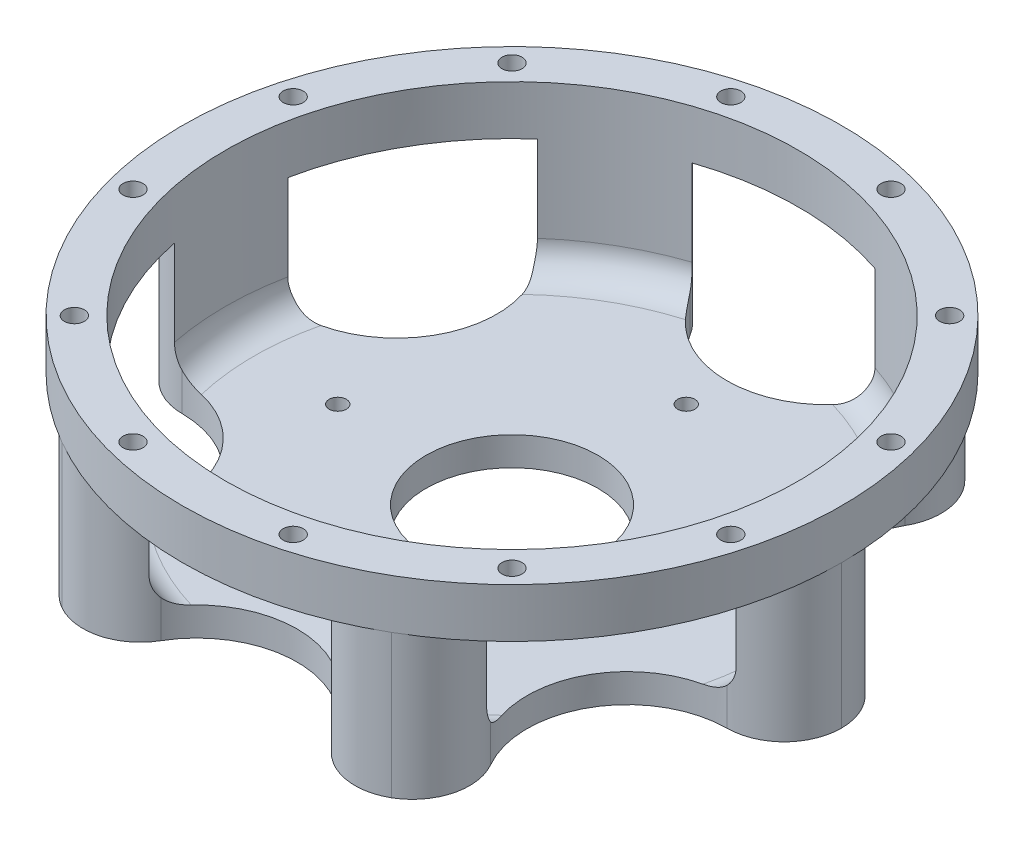
from build123d import *

# Parameters (mm, degrees)
SKETCH1_R           = 57.5
BOSS_EXTRUDE1_DEPTH = 33.6
SKETCH2_R           = 50
CUT_EXTRUDE1_DEPTH  = 28.6
SKETCH7_R           = 1.75
CUT_EXTRUDE4_DEPTH  = 10
FILLET2_R           = 5
SKETCH3_R           = 17.5
CUT_EXTRUDE2_DEPTH  = 25
FILLET1_R           = 10
CIRPATTERN2_DEPTH   = 25
SKETCH5_R           = 1.5
SKETCH5_R_2         = 15
CUT_EXTRUDE3_DEPTH  = 25
CIRPATTERN3_COUNT   = 6


# Read off the part's stored shape, not the designer's step: CirPattern2
with BuildPart() as part:
    # Sketch1 → Boss-Extrude1 (new body)
    with BuildSketch(Plane(origin=(0, 0, 0), x_dir=(1, 0, 0), z_dir=(0, 1, 0))):
        with Locations(Location((0, 0, 0), (0, 0, 270))):
            Circle(SKETCH1_R)
    extrude(amount=BOSS_EXTRUDE1_DEPTH)

    # Sketch2 → Cut-Extrude1 (cut)
    with BuildSketch(Plane(origin=(0, 33.6, 0), x_dir=(1, 0, 0), z_dir=(0, 1, 0))):
        with Locations(Location((0, 0, 0), (0, 0, 270))):
            Circle(SKETCH2_R)
    extrude(amount=-CUT_EXTRUDE1_DEPTH, mode=Mode.SUBTRACT)

    # Sketch7 → Cut-Extrude4 (cut)
    with BuildSketch(Plane(origin=(0, 33.6, 0), x_dir=(1, 0, 0), z_dir=(0, 1, 0))):
        with Locations(Location((-13.976228436, 52.15999462, 0), (0, 0, 270))):
            Circle(SKETCH7_R)
        with Locations(Location((13.976228436, 52.15999462, 0), (0, 0, 270))):
            Circle(SKETCH7_R)
    cut_extrude4 = extrude(amount=-CUT_EXTRUDE4_DEPTH, mode=Mode.SUBTRACT)

    # Fillet2
    fillet2_edges = [part.edges().sort_by_distance(p)[0] for p in [
        (0, 5, -50),
    ]]
    fillet(fillet2_edges, radius=FILLET2_R)

    # Sketch3 → Cut-Extrude2 (cut)
    with BuildSketch(Plane.XZ):
        with Locations((0, 55)):
            Circle(SKETCH3_R)
    extrude(amount=-CUT_EXTRUDE2_DEPTH, mode=Mode.SUBTRACT)

    # Fillet1
    # the kernel refuses this fillet: 10 mm, written as the material it takes off along each edge
    with BuildSketch(Plane(origin=(-17.498524141, 25, 54.772727273), x_dir=(0.2673887878652172, 0, -0.9635887276862313), z_dir=(0, -1, 0))) as fillet1_piece_1:
        with BuildLine():
            CenterArc((11.468344426, -9.669800453), FILLET1_R, 104.764821464, 89.725856468)
            ThreePointArc((1.78646078, -12.172025276), (0.566760136, -6.133927943), (0, 0))
            ThreePointArc((0, 0), (4.459911721, -0.577849208), (8.919823443, 0))
        make_face()
    extrude(amount=55.756060526, mode=Mode.SUBTRACT)
    with BuildSketch(Plane(origin=(17.498524141, 25, 54.772727273), x_dir=(-0.2673887878652174, 0, -0.9635887276862313), z_dir=(0, -1, 0))) as fillet1_piece_2:
        with BuildLine():
            CenterArc((11.468344426, 9.669800453), FILLET1_R, 165.509322068, 89.725856468)
            ThreePointArc((1.78646078, 12.172025276), (0.566760136, 6.133927943), (0, 0))
            ThreePointArc((0, 0), (4.459911721, 0.577849208), (8.919823443, 0))
        make_face()
    extrude(amount=55.756060526, mode=Mode.SUBTRACT)

    # CirPattern2 outline → CirPattern2 (cut)
    with BuildSketch(Plane(origin=(0, 0, 0), x_dir=(1, 0, 0), z_dir=(0, 1, 0))):
        with BuildLine():
            ThreePointArc((-32.43431744, -36.177486186), (-32.475952642, -18.75), (-47.547780802, -10.000199764))
            ThreePointArc((-47.547780802, -10.000199764), (-54.587917435, -7.054491856), (-57.499999999, -0.000380002))
            ThreePointArc((-57.499999999, -0.000380002), (-49.796460718, -28.75), (-28.750329091, -49.796270715))
            ThreePointArc((-28.750329091, -49.796270715), (-33.403327875, -43.747277311), (-32.43431744, -36.177486186))
        make_face()
        with BuildLine():
            ThreePointArc((-32.43431744, 36.177486186), (-33.403327875, 43.747277311), (-28.750329091, 49.796270715))
            ThreePointArc((-28.750329091, 49.796270715), (-49.796460718, 28.75), (-57.499999999, 0.000380002))
            ThreePointArc((-57.499999999, 0.000380002), (-54.587917435, 7.054491856), (-47.547780802, 10.000199764))
            ThreePointArc((-47.547780802, 10.000199764), (-32.475952642, 18.75), (-32.43431744, 36.177486186))
        make_face()
        with BuildLine():
            ThreePointArc((57.499999999, -0.000380002), (54.587917435, -7.054491856), (47.547780802, -10.000199764))
            ThreePointArc((47.547780802, -10.000199764), (32.475952642, -18.75), (32.43431744, -36.177486186))
            ThreePointArc((32.43431744, -36.177486186), (33.403327875, -43.747277311), (28.750329091, -49.796270715))
            ThreePointArc((28.750329091, -49.796270715), (49.796460718, -28.75), (57.499999999, -0.000380002))
        make_face()
        with BuildLine():
            ThreePointArc((15.113463363, 46.17768595), (21.18458956, 50.801769166), (28.749670908, 49.796650718))
            ThreePointArc((28.749670908, 49.796650718), (0, 57.5), (-28.749670908, 49.796650718))
            ThreePointArc((-28.749670908, 49.796650718), (-21.18458956, 50.801769166), (-15.113463363, 46.17768595))
            ThreePointArc((-15.113463363, 46.17768595), (0, 37.5), (15.113463363, 46.17768595))
        make_face()
        with BuildLine():
            ThreePointArc((28.750329091, 49.796270715), (33.403327875, 43.747277311), (32.43431744, 36.177486186))
            ThreePointArc((32.43431744, 36.177486186), (32.475952642, 18.75), (47.547780802, 10.000199764))
            ThreePointArc((47.547780802, 10.000199764), (54.587917435, 7.054491856), (57.499999999, 0.000380002))
            ThreePointArc((57.499999999, 0.000380002), (49.796460718, 28.75), (28.750329091, 49.796270715))
        make_face()
    extrude(amount=CIRPATTERN2_DEPTH, mode=Mode.SUBTRACT)

    # Sketch5 → Cut-Extrude3 (cut)
    with BuildSketch(Plane.XZ):
        with Locations(Location((0, 30.405591591, 0), (0, 0, 270))):
            Circle(SKETCH5_R)
        with Locations(Location((30.405591591, 0, 0), (0, 0, 270))):
            Circle(SKETCH5_R)
        with Locations(Location((0, -30.405591591, 0), (0, 0, 270))):
            Circle(SKETCH5_R)
        with Locations(Location((-30.405591591, 0, 0), (0, 0, 270))):
            Circle(SKETCH5_R)
        with Locations(Location((0, 0, 0), (0, 0, 270))):
            Circle(SKETCH5_R_2)
    extrude(amount=-CUT_EXTRUDE3_DEPTH, mode=Mode.SUBTRACT)

    # CirPattern3: Cut-Extrude4 ×6 about axis
    cirpattern3_axis = Axis((0, 0, 0), (0, 1, 0))
    for i in range(1, CIRPATTERN3_COUNT):
        add(cut_extrude4.rotate(cirpattern3_axis, i * 360 / CIRPATTERN3_COUNT), mode=Mode.SUBTRACT)


solid = part.part
